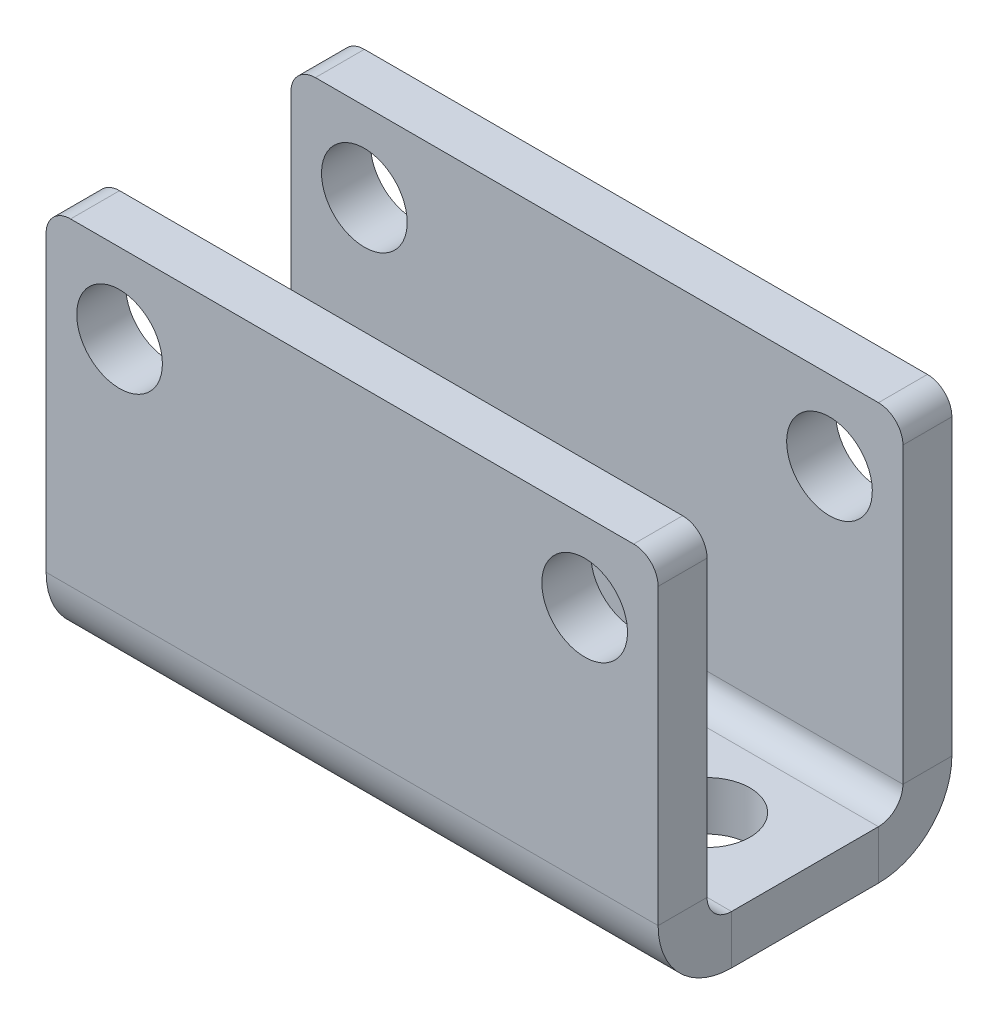
from build123d import *

# Parameters (mm, degrees)
ESBO_O9_W                      = 25
ESBO_O9_H                      = 16
FLANGE_BASE2_DEPTH             = 2
ARESTA_FLANGE2_STRIP_W         = 10
ARESTA_FLANGE2_STRIP_H         = 2
ARESTA_FLANGE2_STRIP_CUT_DEPTH = 25
ARESTA_FLANGE2_DEPTH           = 25
ARESTA_FLANGE3_STRIP_W         = 10
ARESTA_FLANGE3_STRIP_H         = 2
ARESTA_FLANGE3_STRIP_CUT_DEPTH = 25
ARESTA_FLANGE3_DEPTH           = 25
FILETE1_R                      = 1
CORTE_EXTRUS_O1_REACH          = 34.016
ESBO_O21_R                     = 1.75
ESBO_O22_R                     = 1.75
CORTE_EXTRUS_O2_DEPTH          = 10


# Sheet-metal steps are written as plain solids
with BuildPart() as part:
    # Esboço9 → Flange-base2 (new body)
    with BuildSketch(Plane.XY):
        with Locations((12.5, 8)):
            Rectangle(ESBO_O9_W, ESBO_O9_H)
    extrude(amount=FLANGE_BASE2_DEPTH)

    # Aresta-Flange2 strip (across the edge) → Aresta-Flange2 strip cut (cut)
    with BuildSketch(Plane(origin=(25, 0, 0), x_dir=(0, 1, 0), z_dir=(-1, 0, 0))):
        with Locations((-2, -1)):
            Rectangle(ARESTA_FLANGE2_STRIP_W, ARESTA_FLANGE2_STRIP_H)
    extrude(amount=ARESTA_FLANGE2_STRIP_CUT_DEPTH, mode=Mode.SUBTRACT)

    # Aresta-Flange2 section (across the edge) → Aresta-Flange2 (add)
    with BuildSketch(Plane(origin=(25, 0, 0), x_dir=(0, 1, 0), z_dir=(-1, 0, 0))):
        with BuildLine():
            Line((0, 1), (0, 10))
            Line((0, 10), (2, 10))
            Line((2, 10), (2, 1))
            ThreePointArc((2, 1), (2.292893219, 0.292893219), (3, 0))
            Line((3, 0), (3, -2))
            ThreePointArc((3, -2), (0.878679656, -1.121320344), (0, 1))
        make_face()
    extrude(amount=ARESTA_FLANGE2_DEPTH)

    # Aresta-Flange3 strip (across the edge) → Aresta-Flange3 strip cut (cut)
    with BuildSketch(Plane(origin=(25, 2, -10), x_dir=(0, 0, 1), z_dir=(-1, 0, 0))):
        with Locations((-2, -1)):
            Rectangle(ARESTA_FLANGE3_STRIP_W, ARESTA_FLANGE3_STRIP_H)
    extrude(amount=ARESTA_FLANGE3_STRIP_CUT_DEPTH, mode=Mode.SUBTRACT)

    # Aresta-Flange3 section (across the edge) → Aresta-Flange3 (add)
    with BuildSketch(Plane(origin=(25, 2, -10), x_dir=(0, 0, 1), z_dir=(-1, 0, 0))):
        with BuildLine():
            Line((0, 1), (0, 14))
            Line((0, 14), (2, 14))
            Line((2, 14), (2, 1))
            ThreePointArc((2, 1), (2.292893219, 0.292893219), (3, 0))
            Line((3, 0), (3, -2))
            ThreePointArc((3, -2), (0.878679656, -1.121320344), (0, 1))
        make_face()
    extrude(amount=ARESTA_FLANGE3_DEPTH)

    # Filete1
    filete1_edges = [part.edges().sort_by_distance(p)[0] for p in [
        (25, 16, -9),
        (0, 16, -9),
        (0, 16, 1),
        (25, 16, 1),
    ]]
    fillet(filete1_edges, radius=FILETE1_R)

    # Corte-extrusão1: up to this face of the body (flat: up to its plane)
    corte_extrus_o1_end = Plane(part.part.faces().sort_by_distance((12.5, 9.491699951, -10))[0])
    # Esboço21 → Corte-extrusão1 (cut, up to the picked face)
    with BuildSketch(Plane.XY.offset(2), mode=Mode.PRIVATE) as corte_extrus_o1_sk1:
        with Locations(Location((3, 12.75, 0), (0, 0, 270))):
            Circle(ESBO_O21_R)
    corte_extrus_o1_tool1 = split(extrude(corte_extrus_o1_sk1.sketch, amount=-CORTE_EXTRUS_O1_REACH, mode=Mode.PRIVATE), bisect_by=corte_extrus_o1_end, keep=Keep.BOTH, mode=Mode.PRIVATE)
    # Esboço21 → Corte-extrusão1 (cut, up to the picked face)
    with BuildSketch(Plane.XY.offset(2), mode=Mode.PRIVATE) as corte_extrus_o1_sk2:
        with Locations(Location((22, 12.75, 0), (0, 0, 270))):
            Circle(ESBO_O21_R)
    corte_extrus_o1_tool2 = split(extrude(corte_extrus_o1_sk2.sketch, amount=-CORTE_EXTRUS_O1_REACH, mode=Mode.PRIVATE), bisect_by=corte_extrus_o1_end, keep=Keep.BOTH, mode=Mode.PRIVATE)
    add(corte_extrus_o1_tool1.solids().sort_by(Axis((3, 12.75, 2), (0, 0, -1)))[0], mode=Mode.SUBTRACT)
    add(corte_extrus_o1_tool2.solids().sort_by(Axis((22, 12.75, 2), (0, 0, -1)))[0], mode=Mode.SUBTRACT)

    # Esboço22 → Corte-extrusão2 (cut)
    with BuildSketch(Plane(origin=(0, 2, 0), x_dir=(1, 0, 0), z_dir=(0, 1, 0))):
        with Locations(Location((4, 4, 0), (0, 0, 270))):
            Circle(ESBO_O22_R)
        with Locations(Location((21, 4, 0), (0, 0, 270))):
            Circle(ESBO_O22_R)
    extrude(amount=-CORTE_EXTRUS_O2_DEPTH, mode=Mode.SUBTRACT)


solid = part.part
